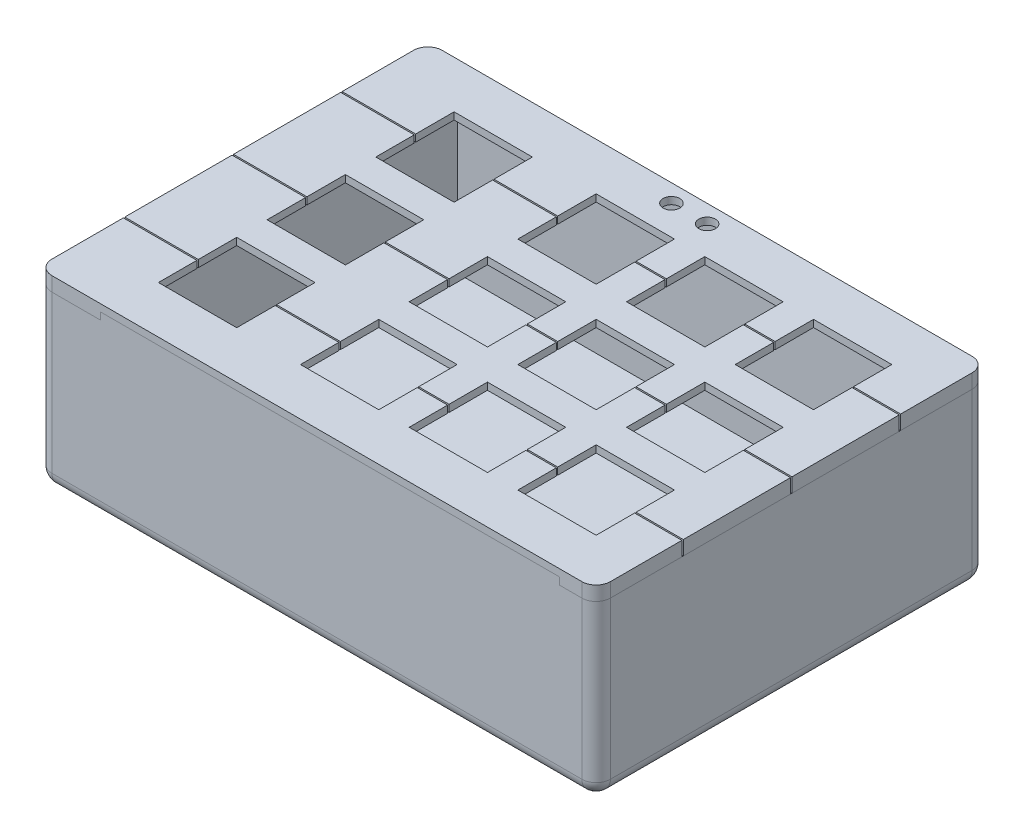
from build123d import *

# Parameters (mm, degrees)
SKETCH1_W                     = 99.4664
SKETCH1_H                     = 69.4944
SKETCH1_W_2                   = 13.9446
SKETCH1_H_2                   = 13.9446
BOSS_EXTRUDE1_DEPTH           = 1.27
SKETCH6_W                     = 11.1887
SKETCH6_H                     = 69.4944
SKETCH6_W_2                   = 6.5151
BOSS_EXTRUDE2_DEPTH           = 1.27
SKETCH2_W                     = 99.4664
SKETCH2_H                     = 0.254
CUT_EXTRUDE_THIN2_DEPTH       = 61.722406821
SKETCH9_R                     = 1.5875
BOSS_EXTRUDE3_DEPTH           = 6.35
BOSS_EXTRUDE3_DRAFT           = 4
BOSS_EXTRUDE3_PROFILE_2_DEPTH = 6.35
BOSS_EXTRUDE3_PROFILE_2_DRAFT = 4
BOSS_EXTRUDE3_PROFILE_3_DEPTH = 6.35
BOSS_EXTRUDE3_PROFILE_3_DRAFT = 4
BOSS_EXTRUDE3_PROFILE_4_DEPTH = 6.35
BOSS_EXTRUDE3_PROFILE_4_DRAFT = 4
BOSS_EXTRUDE3_PROFILE_5_DEPTH = 6.35
BOSS_EXTRUDE3_PROFILE_5_DRAFT = 4
BOSS_EXTRUDE3_PROFILE_6_DEPTH = 6.35
BOSS_EXTRUDE3_PROFILE_6_DRAFT = 4
BOSS_EXTRUDE3_PROFILE_7_DEPTH = 6.35
BOSS_EXTRUDE3_PROFILE_7_DRAFT = 4
BOSS_EXTRUDE3_PROFILE_8_DEPTH = 6.35
BOSS_EXTRUDE3_PROFILE_8_DRAFT = 4
SKETCH10_W                    = 99.4664
SKETCH10_H                    = 69.4944
BOSS_EXTRUDE4_DEPTH           = 1.27
SKETCH11_W                    = 86.4362
SKETCH11_H                    = 66.9544
BOSS_EXTRUDE5_DEPTH           = 29.21
SKETCH12_W                    = 81.7626
SKETCH12_H                    = 1.27
BOSS_EXTRUDE6_DEPTH           = 1.27
SKETCH13_R                    = 1.4859
CUT_EXTRUDE1_DEPTH            = 1.27
SKETCH14_W                    = 11.43
SKETCH14_H                    = 7.62
CUT_EXTRUDE3_DEPTH            = 6.5151
SKETCH16_R                    = 1.7145
CUT_EXTRUDE5_DEPTH            = 6.604
CHAMFER1_SIZE                 = 0.508
FILLET1_R                     = 2.54
FILLET2_R                     = 2.54
FILLET3_R                     = 2.54


with BuildPart() as part:
    # Sketch1 → Boss-Extrude1 (new body)
    with BuildSketch(Plane(origin=(0, 0, 0), x_dir=(1, 0, 0), z_dir=(0, 1, 0))):
        Rectangle(SKETCH1_W, SKETCH1_H)
        with Locations((-4.3688, 19.3548)):
            Rectangle(SKETCH1_W_2, SKETCH1_H_2, mode=Mode.SUBTRACT)
        with Locations((14.986, 19.3548)):
            Rectangle(SKETCH1_W_2, SKETCH1_H_2, mode=Mode.SUBTRACT)
        with Locations((34.3408, 19.3548)):
            Rectangle(SKETCH1_W_2, SKETCH1_H_2, mode=Mode.SUBTRACT)
        with Locations((-4.3688, 0)):
            Rectangle(SKETCH1_W_2, SKETCH1_H_2, mode=Mode.SUBTRACT)
        with Locations((14.986, 0)):
            Rectangle(SKETCH1_W_2, SKETCH1_H_2, mode=Mode.SUBTRACT)
        with Locations((34.3408, 0)):
            Rectangle(SKETCH1_W_2, SKETCH1_H_2, mode=Mode.SUBTRACT)
        with Locations((-4.3688, -19.3548)):
            Rectangle(SKETCH1_W_2, SKETCH1_H_2, mode=Mode.SUBTRACT)
        with Locations((14.986, -19.3548)):
            Rectangle(SKETCH1_W_2, SKETCH1_H_2, mode=Mode.SUBTRACT)
        with Locations((34.3408, -19.3548)):
            Rectangle(SKETCH1_W_2, SKETCH1_H_2, mode=Mode.SUBTRACT)
        with Locations((-29.6672, 19.3548)):
            Rectangle(SKETCH1_W_2, SKETCH1_H_2, mode=Mode.SUBTRACT)
        with Locations((-29.6672, 0)):
            Rectangle(SKETCH1_W_2, SKETCH1_H_2, mode=Mode.SUBTRACT)
        with Locations((-29.6672, -19.3548)):
            Rectangle(SKETCH1_W_2, SKETCH1_H_2, mode=Mode.SUBTRACT)
    extrude(amount=BOSS_EXTRUDE1_DEPTH)

    # Sketch6 → Boss-Extrude2 (add)
    with BuildSketch(Plane.XZ):
        with Locations((-44.13885, 0)):
            Rectangle(SKETCH6_W, SKETCH6_H)
        with Locations((46.47565, 0)):
            Rectangle(SKETCH6_W_2, SKETCH6_H)
    extrude(amount=BOSS_EXTRUDE2_DEPTH)

    # Sketch2 → Cut-Extrude-Thin2 (cut, through all)
    with BuildSketch(Plane(origin=(0, 1.27, 0), x_dir=(1, 0, 0), z_dir=(0, 1, 0))):
        with Locations((0, 19.3548)):
            Rectangle(SKETCH2_W, SKETCH2_H)
        Rectangle(SKETCH2_W, SKETCH2_H)
        with Locations((0, -19.3548)):
            Rectangle(SKETCH2_W, SKETCH2_H)
    extrude(amount=-CUT_EXTRUDE_THIN2_DEPTH, mode=Mode.SUBTRACT)


with BuildPart() as cut_extrude_thin2_piece_1:
    # of the separate pieces the step leaves, piece 1, a body of its own (cut_extrude_thin2_pieces)
    add(part.part.solids().sort_by_distance((-49.7332, 1.27, -19.2278))[0])


with BuildPart() as cut_extrude_thin2_piece_2:
    # of the separate pieces the step leaves, piece 2, a body of its own (cut_extrude_thin2_pieces)
    add(part.part.solids().sort_by_distance((-49.7332, 1.27, 0.127))[0])


with BuildPart() as cut_extrude_thin2_piece_3:
    # of the separate pieces the step leaves, piece 3, a body of its own (cut_extrude_thin2_pieces)
    add(part.part.solids().sort_by_distance((-49.7332, 1.27, 34.7472))[0])


with BuildPart() as cut_extrude_thin2_piece_4:
    # of the separate pieces the step leaves, piece 4, a body of its own (cut_extrude_thin2_pieces)
    add(part.part.solids().sort_by_distance((-49.7332, 1.27, -34.7472))[0])


with BuildPart() as boss_extrude3_tool:
    # Sketch9 → Boss-Extrude3 (with draft: the straight prism first)
    with BuildSketch(Plane.XZ.offset(1.27)):
        with Locations((-46.47565, -27.1145)):
            Circle(SKETCH9_R)
    extrude(amount=BOSS_EXTRUDE3_DEPTH)
    # Boss-Extrude3: the draft: its side faces are tilted about the plane it starts from
    boss_extrude3_sides = [boss_extrude3_tool.faces().sort_by_distance(p)[0] for p in [
        (-48.06315, -4.445, -27.1145),
    ]]
    draft(boss_extrude3_sides, Plane.XZ.offset(1.27), BOSS_EXTRUDE3_DRAFT)


with BuildPart() as cut_extrude_thin2_piece_4_1:
    add(cut_extrude_thin2_piece_4.part)

    # Boss-Extrude3: add boss_extrude3_tool
    add(boss_extrude3_tool.part)


with BuildPart() as boss_extrude3_profile_2_tool:
    # Sketch9 → Boss-Extrude3 profile 2 (with draft: the straight prism first)
    with BuildSketch(Plane.XZ.offset(1.27)):
        with Locations((-46.47565, -9.6774)):
            Circle(SKETCH9_R)
    extrude(amount=BOSS_EXTRUDE3_PROFILE_2_DEPTH)
    # Boss-Extrude3 profile 2: the draft: its side faces are tilted about the plane it starts from
    boss_extrude3_profile_2_sides = [boss_extrude3_profile_2_tool.faces().sort_by_distance(p)[0] for p in [
        (-48.06315, -4.445, -9.6774),
    ]]
    draft(boss_extrude3_profile_2_sides, Plane.XZ.offset(1.27), BOSS_EXTRUDE3_PROFILE_2_DRAFT)


with BuildPart() as cut_extrude_thin2_piece_1_1:
    add(cut_extrude_thin2_piece_1.part)

    # Boss-Extrude3 profile 2: add boss_extrude3_profile_2_tool
    add(boss_extrude3_profile_2_tool.part)


with BuildPart() as boss_extrude3_profile_3_tool:
    # Sketch9 → Boss-Extrude3 profile 3 (with draft: the straight prism first)
    with BuildSketch(Plane.XZ.offset(1.27)):
        with Locations((-46.47565, 9.6774)):
            Circle(SKETCH9_R)
    extrude(amount=BOSS_EXTRUDE3_PROFILE_3_DEPTH)
    # Boss-Extrude3 profile 3: the draft: its side faces are tilted about the plane it starts from
    boss_extrude3_profile_3_sides = [boss_extrude3_profile_3_tool.faces().sort_by_distance(p)[0] for p in [
        (-48.06315, -4.445, 9.6774),
    ]]
    draft(boss_extrude3_profile_3_sides, Plane.XZ.offset(1.27), BOSS_EXTRUDE3_PROFILE_3_DRAFT)


with BuildPart() as cut_extrude_thin2_piece_2_1:
    add(cut_extrude_thin2_piece_2.part)

    # Boss-Extrude3 profile 3: add boss_extrude3_profile_3_tool
    add(boss_extrude3_profile_3_tool.part)


with BuildPart() as boss_extrude3_profile_4_tool:
    # Sketch9 → Boss-Extrude3 profile 4 (with draft: the straight prism first)
    with BuildSketch(Plane.XZ.offset(1.27)):
        with Locations((-46.47565, 27.1145)):
            Circle(SKETCH9_R)
    extrude(amount=BOSS_EXTRUDE3_PROFILE_4_DEPTH)
    # Boss-Extrude3 profile 4: the draft: its side faces are tilted about the plane it starts from
    boss_extrude3_profile_4_sides = [boss_extrude3_profile_4_tool.faces().sort_by_distance(p)[0] for p in [
        (-48.06315, -4.445, 27.1145),
    ]]
    draft(boss_extrude3_profile_4_sides, Plane.XZ.offset(1.27), BOSS_EXTRUDE3_PROFILE_4_DRAFT)


with BuildPart() as cut_extrude_thin2_piece_3_1:
    add(cut_extrude_thin2_piece_3.part)

    # Boss-Extrude3 profile 4: add boss_extrude3_profile_4_tool
    add(boss_extrude3_profile_4_tool.part)


with BuildPart() as boss_extrude3_profile_5_tool:
    # Sketch9 → Boss-Extrude3 profile 5 (with draft: the straight prism first)
    with BuildSketch(Plane.XZ.offset(1.27)):
        with Locations((46.47565, 27.1145)):
            Circle(SKETCH9_R)
    extrude(amount=BOSS_EXTRUDE3_PROFILE_5_DEPTH)
    # Boss-Extrude3 profile 5: the draft: its side faces are tilted about the plane it starts from
    boss_extrude3_profile_5_sides = [boss_extrude3_profile_5_tool.faces().sort_by_distance(p)[0] for p in [
        (44.88815, -4.445, 27.1145),
    ]]
    draft(boss_extrude3_profile_5_sides, Plane.XZ.offset(1.27), BOSS_EXTRUDE3_PROFILE_5_DRAFT)


with BuildPart() as cut_extrude_thin2_piece_3_2:
    add(cut_extrude_thin2_piece_3_1.part)

    # Boss-Extrude3 profile 5: add boss_extrude3_profile_5_tool
    add(boss_extrude3_profile_5_tool.part)

    # Fillet2
    fillet2_edges = [cut_extrude_thin2_piece_3_2.edges().sort_by_distance(p)[0] for p in [
        (-49.7332, 0, 34.7472),
        (49.7332, 0, 34.7472),
    ]]
    fillet(fillet2_edges, radius=FILLET2_R)


with BuildPart() as boss_extrude3_profile_6_tool:
    # Sketch9 → Boss-Extrude3 profile 6 (with draft: the straight prism first)
    with BuildSketch(Plane.XZ.offset(1.27)):
        with Locations((46.47565, 9.6774)):
            Circle(SKETCH9_R)
    extrude(amount=BOSS_EXTRUDE3_PROFILE_6_DEPTH)
    # Boss-Extrude3 profile 6: the draft: its side faces are tilted about the plane it starts from
    boss_extrude3_profile_6_sides = [boss_extrude3_profile_6_tool.faces().sort_by_distance(p)[0] for p in [
        (44.88815, -4.445, 9.6774),
    ]]
    draft(boss_extrude3_profile_6_sides, Plane.XZ.offset(1.27), BOSS_EXTRUDE3_PROFILE_6_DRAFT)


with BuildPart() as cut_extrude_thin2_piece_2_2:
    add(cut_extrude_thin2_piece_2_1.part)

    # Boss-Extrude3 profile 6: add boss_extrude3_profile_6_tool
    add(boss_extrude3_profile_6_tool.part)


with BuildPart() as boss_extrude3_profile_7_tool:
    # Sketch9 → Boss-Extrude3 profile 7 (with draft: the straight prism first)
    with BuildSketch(Plane.XZ.offset(1.27)):
        with Locations((46.47565, -9.6774)):
            Circle(SKETCH9_R)
    extrude(amount=BOSS_EXTRUDE3_PROFILE_7_DEPTH)
    # Boss-Extrude3 profile 7: the draft: its side faces are tilted about the plane it starts from
    boss_extrude3_profile_7_sides = [boss_extrude3_profile_7_tool.faces().sort_by_distance(p)[0] for p in [
        (44.88815, -4.445, -9.6774),
    ]]
    draft(boss_extrude3_profile_7_sides, Plane.XZ.offset(1.27), BOSS_EXTRUDE3_PROFILE_7_DRAFT)


with BuildPart() as cut_extrude_thin2_piece_1_2:
    add(cut_extrude_thin2_piece_1_1.part)

    # Boss-Extrude3 profile 7: add boss_extrude3_profile_7_tool
    add(boss_extrude3_profile_7_tool.part)


with BuildPart() as boss_extrude3_profile_8_tool:
    # Sketch9 → Boss-Extrude3 profile 8 (with draft: the straight prism first)
    with BuildSketch(Plane.XZ.offset(1.27)):
        with Locations((46.47565, -27.1145)):
            Circle(SKETCH9_R)
    extrude(amount=BOSS_EXTRUDE3_PROFILE_8_DEPTH)
    # Boss-Extrude3 profile 8: the draft: its side faces are tilted about the plane it starts from
    boss_extrude3_profile_8_sides = [boss_extrude3_profile_8_tool.faces().sort_by_distance(p)[0] for p in [
        (44.88815, -4.445, -27.1145),
    ]]
    draft(boss_extrude3_profile_8_sides, Plane.XZ.offset(1.27), BOSS_EXTRUDE3_PROFILE_8_DRAFT)


with BuildPart() as cut_extrude_thin2_piece_4_2:
    add(cut_extrude_thin2_piece_4_1.part)

    # Boss-Extrude3 profile 8: add boss_extrude3_profile_8_tool
    add(boss_extrude3_profile_8_tool.part)

    # Sketch13 → Cut-Extrude1 (cut)
    with BuildSketch(Plane(origin=(0, 1.27, 0), x_dir=(1, 0, 0), z_dir=(0, 1, 0))):
        with Locations(Location((3.175, 31.5722, 0), (0, 0, 270))):
            Circle(SKETCH13_R)
        with Locations(Location((-3.175, 31.5722, 0), (0, 0, 270))):
            Circle(SKETCH13_R)
    extrude(amount=-CUT_EXTRUDE1_DEPTH, mode=Mode.SUBTRACT)

    # Fillet3
    fillet3_edges = [cut_extrude_thin2_piece_4_2.edges().sort_by_distance(p)[0] for p in [
        (49.7332, 0, -34.7472),
        (-49.7332, 0, -34.7472),
    ]]
    fillet(fillet3_edges, radius=FILLET3_R)


with BuildPart() as body_5:
    # Sketch10 → Boss-Extrude4 (new body)
    with BuildSketch(Plane(origin=(0, -31.75, 0), x_dir=(-1, 0, 0), z_dir=(0, -1, 0))):
        Rectangle(SKETCH10_W, SKETCH10_H)
    extrude(amount=-BOSS_EXTRUDE4_DEPTH)

    # Sketch11 → Boss-Extrude5 (add)
    with BuildSketch(Plane(origin=(0, -30.48, 0), x_dir=(1, 0, 0), z_dir=(0, 1, 0))):
        Polygon((49.7332, -34.7472), (43.2181, -34.7472), (-43.2181, -34.7472), (-49.7332, -34.7472), (-49.7332, 34.7472), (-43.2181, 34.7472), (43.2181, 34.7472), (49.7332, 34.7472), align=None)
        Rectangle(SKETCH11_W, SKETCH11_H, mode=Mode.SUBTRACT)
    extrude(amount=BOSS_EXTRUDE5_DEPTH)

    # Sketch12 → Boss-Extrude6 (add)
    with BuildSketch(Plane(origin=(0, -1.27, 0), x_dir=(1, 0, 0), z_dir=(0, 1, 0))):
        with Locations((2.3368, -34.1122)):
            Rectangle(SKETCH12_W, SKETCH12_H)
        with Locations((2.3368, 34.1122)):
            Rectangle(SKETCH12_W, SKETCH12_H)
    extrude(amount=BOSS_EXTRUDE6_DEPTH)

    # Sketch14 → Cut-Extrude3 (cut)
    with BuildSketch(Plane.ZY.offset(49.7332)):
        with Locations((0, -26.67)):
            Rectangle(SKETCH14_W, SKETCH14_H)
    extrude(amount=-CUT_EXTRUDE3_DEPTH, mode=Mode.SUBTRACT)

    # Sketch16 → Cut-Extrude5 (cut)
    with BuildSketch(Plane.XZ.offset(1.27)):
        with Locations(Location((46.47565, 27.1145, 0), (0, 0, 90))):
            Circle(SKETCH16_R)
        with Locations(Location((46.47565, 9.6774, 0), (0, 0, 90))):
            Circle(SKETCH16_R)
        with Locations(Location((46.47565, -9.6774, 0), (0, 0, 90))):
            Circle(SKETCH16_R)
        with Locations(Location((46.47565, -27.1145, 0), (0, 0, 90))):
            Circle(SKETCH16_R)
        with Locations(Location((-46.47565, -27.1145, 0), (0, 0, 90))):
            Circle(SKETCH16_R)
        with Locations(Location((-46.47565, -9.6774, 0), (0, 0, 90))):
            Circle(SKETCH16_R)
        with Locations(Location((-46.47565, 9.6774, 0), (0, 0, 90))):
            Circle(SKETCH16_R)
        with Locations(Location((-46.47565, 27.1145, 0), (0, 0, 90))):
            Circle(SKETCH16_R)
    extrude(amount=CUT_EXTRUDE5_DEPTH, mode=Mode.SUBTRACT)

    # Chamfer1
    chamfer1_edges = [body_5.edges().sort_by_distance(p)[0] for p in [
        (46.47565, -1.27, 25.4),
        (46.47565, -1.27, 7.9629),
        (46.47565, -1.27, -11.3919),
        (46.47565, -1.27, -28.829),
        (-46.47565, -1.27, -28.829),
        (-46.47565, -1.27, -11.3919),
        (-46.47565, -1.27, 7.9629),
        (-46.47565, -1.27, 25.4),
    ]]
    chamfer(chamfer1_edges, length=CHAMFER1_SIZE)

    # Fillet1
    # the kernel refuses this fillet: 2.54 mm, written as the material it takes off along each edge
    with BuildSketch(Plane(origin=(-47.1932, -29.21, -32.2072), x_dir=(0, -1, 0), z_dir=(0, 0, -1))) as fillet1_piece_1_section:
        Polygon((0, 0), (FILLET1_R, 0), (FILLET1_R, FILLET1_R), (0, FILLET1_R), align=None)
    fillet1_piece_1 = extrude(amount=FILLET1_R, mode=Mode.PRIVATE)
    fillet1_piece_1 = fillet1_piece_1 - Plane(origin=(-47.1932, -29.21, -32.2072), x_dir=(0.7071067811865475, 0.7071067811865475, 0), z_dir=(0, 0, -1)) * Sphere(FILLET1_R, mode=Mode.PRIVATE)
    add(fillet1_piece_1, mode=Mode.SUBTRACT)
    with BuildSketch(Plane(origin=(-47.1932, -29.21, 32.2072), x_dir=(0, 0, 1), z_dir=(0, -1, 0))) as fillet1_piece_2_section:
        Polygon((0, 0), (FILLET1_R, 0), (FILLET1_R, FILLET1_R), (0, FILLET1_R), align=None)
    fillet1_piece_2 = extrude(amount=FILLET1_R, mode=Mode.PRIVATE)
    fillet1_piece_2 = fillet1_piece_2 - Plane(origin=(-47.1932, -29.21, 32.2072), x_dir=(0.7071067811865475, 0, -0.7071067811865475), z_dir=(0, -1, 0)) * Sphere(FILLET1_R, mode=Mode.PRIVATE)
    add(fillet1_piece_2, mode=Mode.SUBTRACT)
    with BuildSketch(Plane(origin=(47.1932, -29.21, -32.2072), x_dir=(1, 0, 0), z_dir=(0, 0, -1))) as fillet1_piece_3_section:
        Polygon((0, 0), (FILLET1_R, 0), (FILLET1_R, FILLET1_R), (0, FILLET1_R), align=None)
    fillet1_piece_3 = extrude(amount=FILLET1_R, mode=Mode.PRIVATE)
    fillet1_piece_3 = fillet1_piece_3 - Plane(origin=(47.1932, -29.21, -32.2072), x_dir=(-0.7071067811865475, 0.7071067811865475, 0), z_dir=(0, 0, -1)) * Sphere(FILLET1_R, mode=Mode.PRIVATE)
    add(fillet1_piece_3, mode=Mode.SUBTRACT)
    with BuildSketch(Plane(origin=(47.1932, -29.21, 32.2072), x_dir=(0, 0, 1), z_dir=(1, 0, 0))) as fillet1_piece_4_section:
        Polygon((0, 0), (FILLET1_R, 0), (FILLET1_R, FILLET1_R), (0, FILLET1_R), align=None)
    fillet1_piece_4 = extrude(amount=FILLET1_R, mode=Mode.PRIVATE)
    fillet1_piece_4 = fillet1_piece_4 - Plane(origin=(47.1932, -29.21, 32.2072), x_dir=(0, 0.7071067811865475, -0.7071067811865475), z_dir=(1, 0, 0)) * Sphere(FILLET1_R, mode=Mode.PRIVATE)
    add(fillet1_piece_4, mode=Mode.SUBTRACT)
    with BuildSketch(Plane(origin=(-49.7332, -31.75, -32.2072), x_dir=(0, 1, 0), z_dir=(0, 0, 1)), Plane(origin=(49.7332, -31.75, 32.2072), x_dir=(0, 1, 0), z_dir=(0, 0, -1))) as fillet1_piece_5:
        with BuildLine():
            CenterArc((FILLET1_R, -FILLET1_R), FILLET1_R, 90, 90)
            Line((0, -FILLET1_R), (0, 0))
            Line((0, 0), (FILLET1_R, 0))
        make_face()
    extrude(amount=64.4144, mode=Mode.SUBTRACT)
    with BuildSketch(Plane(origin=(47.1932, -31.75, -34.7472), x_dir=(0, 1, 0), z_dir=(-1, 0, 0)), Plane(origin=(-47.1932, -31.75, 34.7472), x_dir=(0, 1, 0), z_dir=(1, 0, 0))) as fillet1_piece_6:
        with BuildLine():
            CenterArc((FILLET1_R, -FILLET1_R), FILLET1_R, 90, 90)
            Line((0, -FILLET1_R), (0, 0))
            Line((0, 0), (FILLET1_R, 0))
        make_face()
    extrude(amount=94.3864, mode=Mode.SUBTRACT)
    with BuildSketch(Plane(origin=(49.7332, -29.21, 34.7472), x_dir=(-1, 0, 0), z_dir=(0, 1, 0)), Plane(origin=(-49.7332, 5.08, -34.7472), x_dir=(0, 0, 1), z_dir=(0, -1, 0)), Plane(origin=(-49.7332, 5.08, 34.7472), x_dir=(1, 0, 0), z_dir=(0, -1, 0))) as fillet1_piece_7:
        with BuildLine():
            CenterArc((FILLET1_R, -FILLET1_R), FILLET1_R, 90, 90)
            Line((0, -FILLET1_R), (0, 0))
            Line((0, 0), (FILLET1_R, 0))
        make_face()
    extrude(amount=34.29, mode=Mode.SUBTRACT)
    with BuildSketch(Plane(origin=(49.7332, -29.21, -34.7472), x_dir=(-1, 0, 0), z_dir=(0, 1, 0))) as fillet1_piece_8:
        with BuildLine():
            CenterArc((FILLET1_R, FILLET1_R), FILLET1_R, 180, 90)
            Line((0, FILLET1_R), (0, 0))
            Line((0, 0), (FILLET1_R, 0))
        make_face()
    extrude(amount=34.29, mode=Mode.SUBTRACT)


solid = Compound([cut_extrude_thin2_piece_3_2.part, cut_extrude_thin2_piece_2_2.part, cut_extrude_thin2_piece_1_2.part, cut_extrude_thin2_piece_4_2.part, body_5.part])
